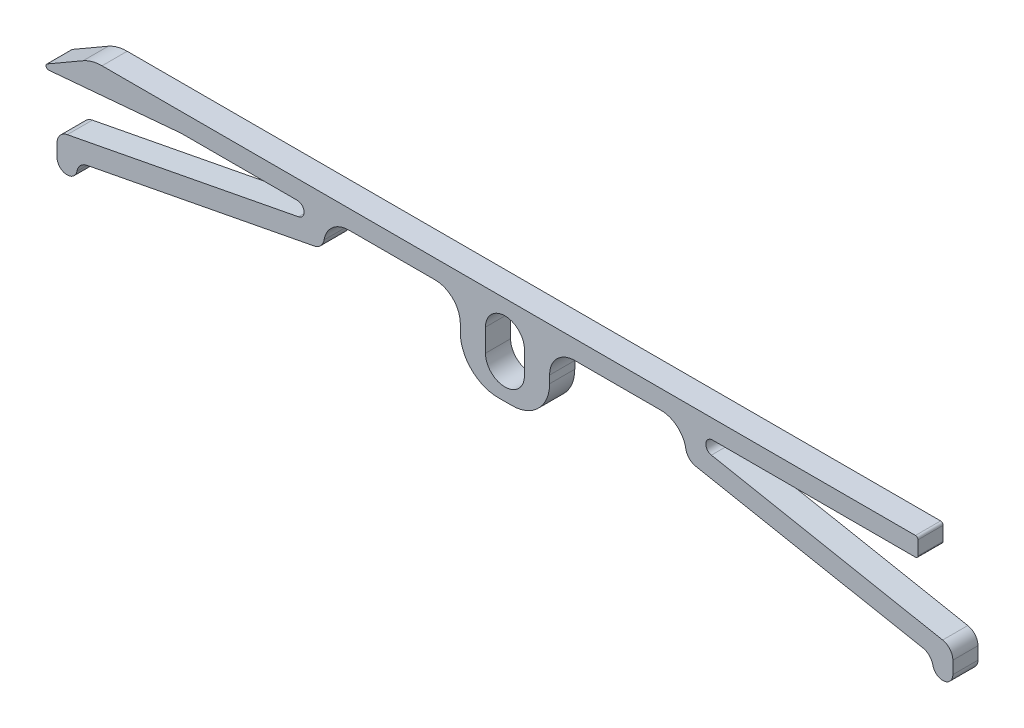
from build123d import *

# Parameters (mm, degrees)
FLAT_DEPTH              = 2
SKETCH3_W               = 7.1
SKETCH3_H               = 7.1
BOSS_EXTRUDE3_DEPTH     = 2
CUT_EXTRUDE1_DEPTH      = 38.889997963
CUT_EXTRUDE1_DEPTH_BACK = 38.889997963
BOSS_EXTRUDE5_DEPTH     = 2
FILLET3_R               = 1
FILLET4_R               = 2
FILLET8_R               = 2
FILLET6_R               = 0.2
FILLET7_R               = 3


with BuildPart() as part:
    # Sketch2 → flat (new body)
    with BuildSketch(Plane.XY):
        Polygon((-32.834936491, 0), (32.834936491, 0), (32.834936491, -1.5), (-25.735011207, -1.5), (-37.165063509, -2.5), align=None)
    extrude(amount=FLAT_DEPTH)

    # Sketch3 → Boss-Extrude3 (add)
    with BuildSketch(Plane(origin=(0, 0, 0), x_dir=(-1, 0, 0), z_dir=(0, 0, -1))):
        with Locations((0, -3.55)):
            Rectangle(SKETCH3_W, SKETCH3_H)
    extrude(amount=-BOSS_EXTRUDE3_DEPTH)

    # Sketch4 → Cut-Extrude1 (cut, two sides: drawn at the far end of the back side and taken through both)
    with BuildSketch(Plane.XY.offset(2).offset(-CUT_EXTRUDE1_DEPTH_BACK)):
        with BuildLine():
            Line((-1.55, -2.75), (-1.55, -4.55))
            ThreePointArc((-1.55, -4.55), (0, -6.1), (1.55, -4.55))
            Line((1.55, -4.55), (1.55, -2.75))
            ThreePointArc((1.55, -2.75), (0, -1.2), (-1.55, -2.75))
        make_face()
    extrude(amount=CUT_EXTRUDE1_DEPTH + CUT_EXTRUDE1_DEPTH_BACK, mode=Mode.SUBTRACT)

    # Sketch6 → Boss-Extrude5 (add)
    with BuildSketch(Plane.XY.offset(2)):
        with BuildLine():
            Line((-16.409257503, -2.585457858), (-35.604897729, -6.278480095))
            Line((-35.604897729, -6.278480095), (-35.604897729, -8.1))
            ThreePointArc((-35.604897729, -8.1), (-34.804897729, -8.9), (-34.004897729, -8.1))
            Line((-34.004897729, -8.1), (-34.004897729, -7.6))
            Line((-34.004897729, -7.6), (-14.365063509, -3.821519905))
            Line((-14.365063509, -3.821519905), (-14.365063509, -1.5))
            Line((-14.365063509, -1.5), (-16.512723649, -1.5))
            ThreePointArc((-16.512723649, -1.5), (-15.96753469, -1.995692576), (-16.409257503, -2.585457858))
        make_face()
    boss_extrude5 = extrude(amount=-BOSS_EXTRUDE5_DEPTH)

    # Mirror4: Boss-Extrude5 across plane
    add(boss_extrude5.mirror(Plane(origin=(0, 0, 0), x_dir=(0, 0, 1), z_dir=(1, 0, 0))))

    # Fillet3
    fillet3_edges = [part.edges().sort_by_distance(p)[0] for p in [
        (-35.604897729, -6.278480095, 1),
        (-34.004897729, -7.6, 1),
        (-14.365063509, -3.821519905, 1),
        (35.604897729, -6.278480095, 1),
        (34.004897729, -7.6, 1),
        (14.365063509, -3.821519905, 1),
    ]]
    fillet(fillet3_edges, radius=FILLET3_R)

    # Fillet4
    fillet4_edges = [part.edges().sort_by_distance(p)[0] for p in [
        (-14.365063509, -1.5, 1),
        (14.365063509, -1.5, 1),
    ]]
    fillet(fillet4_edges, radius=FILLET4_R)

    # Fillet8
    fillet8_edges = [part.edges().sort_by_distance(p)[0] for p in [
        (-3.55, -1.5, 1),
        (3.55, -1.5, 1),
    ]]
    fillet(fillet8_edges, radius=FILLET8_R)

    # Fillet6
    fillet6_edges = [part.edges().sort_by_distance(p)[0] for p in [
        (32.834936491, 0, 1),
        (32.834936491, -1.5, 1),
        (-37.165063509, -2.5, 1),
    ]]
    fillet(fillet6_edges, radius=FILLET6_R)

    # Fillet7
    # the kernel refuses this fillet: 3 mm, written as the material it adds along each edge
    with BuildSketch(Plane(origin=(-25.735011207, -1.5, 0), x_dir=(-0.996194698091746, -0.0871557427476529, 0), z_dir=(0, 0, 1))) as fillet7_piece_1:
        with BuildLine():
            CenterArc((FILLET7_R * 0.0436609429085, FILLET7_R), FILLET7_R, 265, 5)
            Line((-FILLET7_R * 0.0434947998391, FILLET7_R * 0.00380530190825), (0, 0))
            Line((0, 0), (FILLET7_R * 0.0436609429085, 0))
        make_face()
    extrude(amount=2)
    # the kernel refuses this fillet: 3 mm, written as the material it takes off along each edge
    with BuildSketch(Plane(origin=(3.55, -7.1, -7.5), x_dir=(0, 1, 0), z_dir=(0, 0, 1)), Plane(origin=(-3.55, -7.1, -7.5), x_dir=(1, 0, 0), z_dir=(0, 0, 1))) as fillet7_2_piece_1:
        with BuildLine():
            CenterArc((FILLET7_R, FILLET7_R), FILLET7_R, 180, 90)
            Line((0, FILLET7_R), (0, 0))
            Line((0, 0), (FILLET7_R, 0))
        make_face()
    extrude(amount=17, mode=Mode.SUBTRACT)
    with BuildSketch(Plane(origin=(-32.834936491, 0, -2.009618943), x_dir=(1, 0, 0), z_dir=(0, 0, 1))) as fillet7_2_piece_2:
        with BuildLine():
            CenterArc((FILLET7_R * 0.267949192431, -FILLET7_R), FILLET7_R, 90, 30)
            Line((-FILLET7_R * 0.232050807569, -FILLET7_R * 0.133974596216), (0, 0))
            Line((0, 0), (FILLET7_R * 0.267949192431, 0))
        make_face()
    extrude(amount=6.019237886, mode=Mode.SUBTRACT)


solid = part.part
